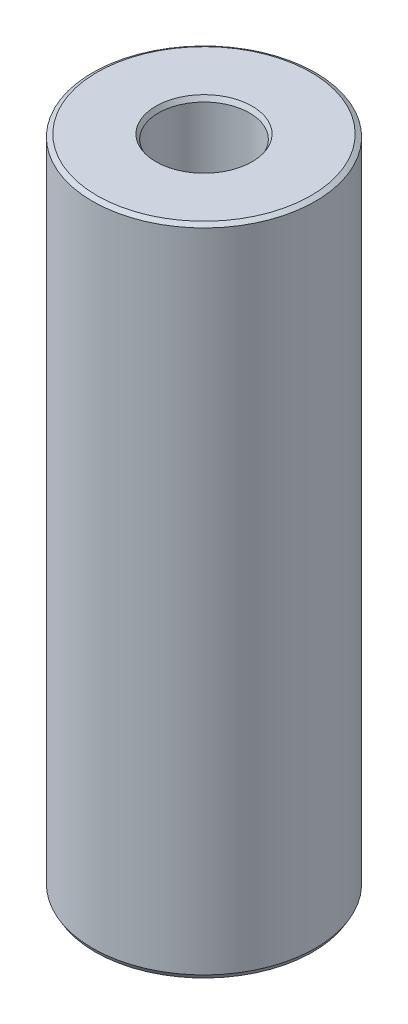
from build123d import *
from OCP.BRepFilletAPI import BRepFilletAPI_MakeChamfer

# Parameters (mm, degrees)
SKETCH1_R           = 47.5
BOSS_EXTRUDE1_DEPTH = 278.738901771
SKETCH2_R           = 19.409466605
CUT_EXTRUDE1_DEPTH  = 287.719157645
CHAMFER1_SIZE       = 1.116166024
CHAMFER1_SIZE2      = 1.933256264


with BuildPart() as part:
    # Sketch1 → Boss-Extrude1 (new body)
    with BuildSketch(Plane(origin=(0, 0, 0), x_dir=(1, 0, 0), z_dir=(0, 1, 0))):
        Circle(SKETCH1_R)
    extrude(amount=BOSS_EXTRUDE1_DEPTH)

    # Sketch2 → Cut-Extrude1 (cut, through all)
    with BuildSketch(Plane(origin=(0, 0, 0), x_dir=(1, 0, 0), z_dir=(0, 1, 0))):
        Circle(SKETCH2_R)
    extrude(amount=CUT_EXTRUDE1_DEPTH, mode=Mode.SUBTRACT)

    # Chamfer1: one chamfer whose edges measure the first distance from different faces: ONE call of the kernel's chamfer builder (chamfer() names one face for all edges)
    chamfer1_edges_1 = [part.edges().sort_by_distance(p)[0] for p in [
        (-19.409466605, 278.738901771, 0),
    ]]
    chamfer1_side_1 = [part.faces().sort_by_distance(p)[0] for p in [
        (-46.156497116, 278.738901771, 0),
    ]]
    chamfer1_edges_2 = [part.edges().sort_by_distance(p)[0] for p in [
        (-19.409466605, 0, 0),
    ]]
    chamfer1_side_2 = [part.faces().sort_by_distance(p)[0] for p in [
        (-19.409466605, 139.369450886, 0),
    ]]
    chamfer1_edges_3 = [part.edges().sort_by_distance(p)[0] for p in [
        (-47.5, 0, 0),
    ]]
    chamfer1_side_3 = [part.faces().sort_by_distance(p)[0] for p in [
        (-46.156497116, 0, 0),
    ]]
    chamfer1_edges_4 = [part.edges().sort_by_distance(p)[0] for p in [
        (-47.5, 278.738901771, 0),
    ]]
    chamfer1_side_4 = [part.faces().sort_by_distance(p)[0] for p in [
        (-47.5, 139.369450886, 0),
    ]]
    chamfer1 = BRepFilletAPI_MakeChamfer(part.part.solid().wrapped)
    for e in chamfer1_edges_1:
        chamfer1.Add(CHAMFER1_SIZE, CHAMFER1_SIZE2, e.wrapped, chamfer1_side_1[0].wrapped)  # the first distance lies on this face
    for e in chamfer1_edges_2:
        chamfer1.Add(CHAMFER1_SIZE, CHAMFER1_SIZE2, e.wrapped, chamfer1_side_2[0].wrapped)  # the first distance lies on this face
    for e in chamfer1_edges_3:
        chamfer1.Add(CHAMFER1_SIZE, CHAMFER1_SIZE2, e.wrapped, chamfer1_side_3[0].wrapped)  # the first distance lies on this face
    for e in chamfer1_edges_4:
        chamfer1.Add(CHAMFER1_SIZE, CHAMFER1_SIZE2, e.wrapped, chamfer1_side_4[0].wrapped)  # the first distance lies on this face
    add(Compound.cast(chamfer1.Shape()), mode=Mode.REPLACE)


solid = part.part
